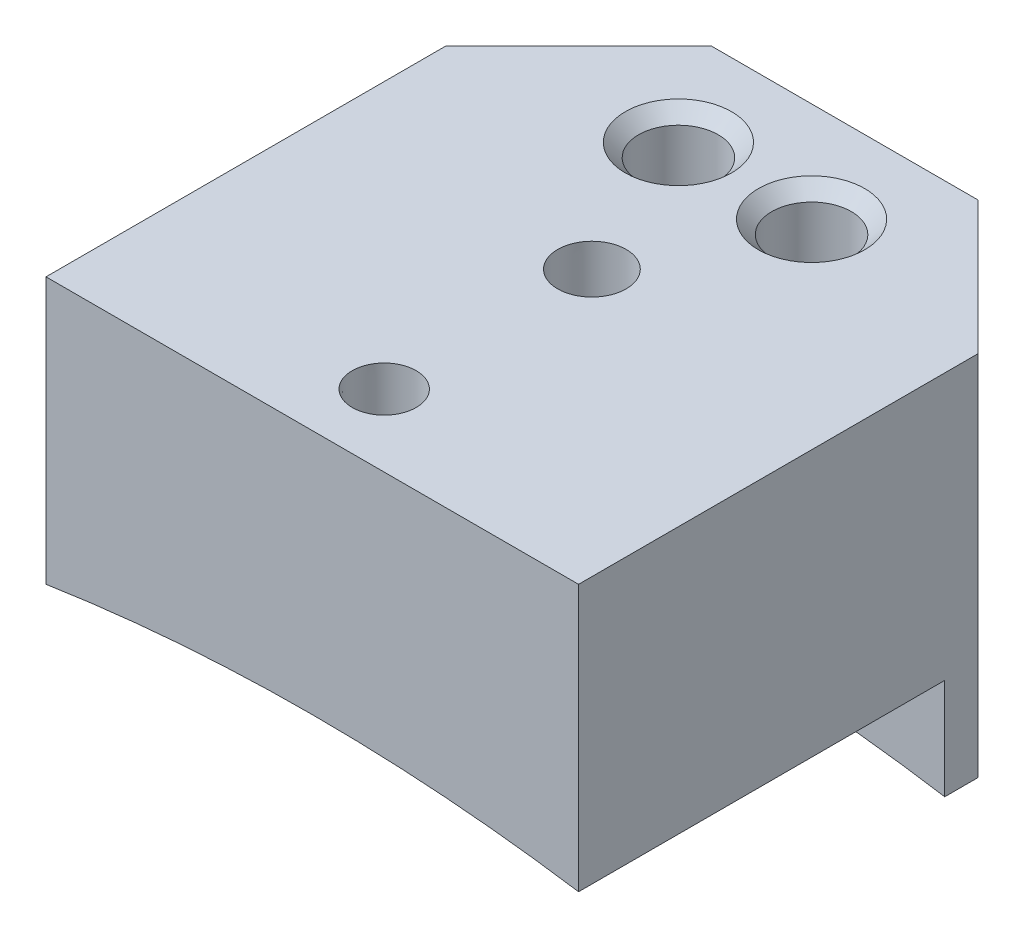
from build123d import *

# Parameters (mm, degrees)
BOSS_EXTRUDE1_DEPTH              = 12.7
CUT_EXTRUDE1_DEPTH               = 41.241448839
CUT_EXTRUDE1_DEPTH_BACK          = 41.241448839
SKETCH2_R                        = 83.82
BOSS_EXTRUDE2_DEPTH              = 7.9375
CHAMFER1_SIZE                    = 6.35
F_10_24_TAPPED_HOLE1_D           = 3.7973
F_10_24_TAPPED_HOLE1_CSINK_D     = 5.0673
F_10_24_TAPPED_HOLE1_CSINK_ANGLE = 90
CUT_EXTRUDE2_DEPTH               = 36.839626758


with BuildPart() as part:
    # Sketch1 → Boss-Extrude1 (new body)
    with BuildSketch(Plane(origin=(0, 0, 0), x_dir=(1, 0, 0), z_dir=(0, 1, 0))):
        Polygon((-28.511825699, 6.495271113), (-22.161825699, 12.845271113), (-9.461825699, 12.845271113), (-3.111825699, 6.495271113), (-3.111825699, -12.554728887), (-28.511825699, -12.554728887), align=None)
    extrude(amount=BOSS_EXTRUDE1_DEPTH)

    # Sketch2 → Cut-Extrude1 (cut, two sides: drawn at the far end of the back side and taken through both)
    with BuildSketch(Plane.XY.offset(12.554728887).offset(-CUT_EXTRUDE1_DEPTH_BACK)):
        with Locations((-15.811825699, -82.852292666)):
            Circle(SKETCH2_R)
    extrude(amount=CUT_EXTRUDE1_DEPTH + CUT_EXTRUDE1_DEPTH_BACK, mode=Mode.SUBTRACT)

    # Sketch5 → Boss-Extrude2 (add)
    with BuildSketch(Plane(origin=(0, 0, -12.845271113), x_dir=(-1, 0, 0), z_dir=(0, 0, -1))):
        with BuildLine():
            Line((3.111825699, 12.7), (3.111825699, 0))
            Line((3.111825699, 0), (3.111825699, -4.808673272))
            ThreePointArc((3.111825699, -4.808673272), (15.811825699, -3.782092666), (28.511825699, -4.808673272))
            Line((28.511825699, -4.808673272), (28.511825699, 0))
            Line((28.511825699, 0), (28.511825699, 12.7))
            Line((28.511825699, 12.7), (3.111825699, 12.7))
        make_face()
    extrude(amount=-BOSS_EXTRUDE2_DEPTH)

    # Chamfer1
    chamfer1_edges = [part.edges().sort_by_distance(p)[0] for p in [
        (-28.511825699, 3.945663364, -12.845271113),
        (-3.111825699, 3.945663364, -12.845271113),
    ]]
    chamfer(chamfer1_edges, length=CHAMFER1_SIZE)

    # #10-24 Tapped Hole1 (through all)
    with Locations(Plane(origin=(0, 12.7, 0), x_dir=(1, 0, 0), z_dir=(0, 1, 0))):
        with Locations((-18.986825699, 8.082771113), (-12.636825699, 8.082771113)):
            CounterSinkHole(F_10_24_TAPPED_HOLE1_D / 2, F_10_24_TAPPED_HOLE1_CSINK_D / 2, counter_sink_angle=F_10_24_TAPPED_HOLE1_CSINK_ANGLE)

    # Sketch6 → Cut-Extrude2 (cut, through all)
    with BuildSketch(Plane(origin=(0, 12.7, 0), x_dir=(1, 0, 0), z_dir=(0, 1, 0))):
        with BuildLine():
            add(Edge.make_bspline(
                [(-15.810187161, -10.649728887), (-15.608816069, -10.649728887), (-15.408777087, -10.609258042), (-15.042113414, -10.456913102), (-14.872283136, -10.343310195), (-14.661403237, -10.132093223), (-14.597095235, -10.053567675), (-14.486747252, -9.887951619), (-14.439987535, -9.800364966), (-14.325350321, -9.523041064), (-14.285983587, -9.325167956), (-14.286290626, -9.023681247), (-14.296234835, -8.924756645), (-14.335129975, -8.729941243), (-14.364583859, -8.633021866), (-14.441157352, -8.448760184), (-14.488024203, -8.361269055), (-14.59887818, -8.19554373), (-14.663276798, -8.117242645), (-14.874254427, -7.906673959), (-15.044430287, -7.793212195), (-15.411336895, -7.641510946), (-15.611812582, -7.601658558), (-15.910183793, -7.601764194), (-16.011184079, -7.611765087), (-16.206424053, -7.650777196), (-16.30141986, -7.679610607), (-16.578437934, -7.794438792), (-16.746192198, -7.906327472), (-16.959455446, -8.119808368), (-17.022421419, -8.196790525), (-17.132721662, -8.361961239), (-17.180436007, -8.451221081), (-17.256716781, -8.635734127), (-17.285478891, -8.730735016), (-17.324351045, -8.926195298), (-17.33424011, -9.027147637), (-17.3340816, -9.325321862), (-17.294056516, -9.525871287), (-17.142043719, -9.892631786), (-17.028500472, -10.062651874), (-16.817622682, -10.273567653), (-16.739189096, -10.337937728), (-16.573527751, -10.448531182), (-16.4859941, -10.495341779), (-16.301435, -10.571837459), (-16.204652049, -10.601138186), (-16.009875231, -10.63984903), (-15.910872707, -10.649728887), (-15.810187161, -10.649728887)],
                knots=[0, 0, 0, 0, 0.0625, 0.0625, 0.125, 0.125, 0.15625, 0.15625, 0.1875, 0.1875, 0.25, 0.25, 0.28125, 0.28125, 0.3125, 0.3125, 0.34375, 0.34375, 0.375, 0.375, 0.4375, 0.4375, 0.5, 0.5, 0.53125, 0.53125, 0.5625, 0.5625, 0.625, 0.625, 0.65625, 0.65625, 0.6875, 0.6875, 0.71875, 0.71875, 0.75, 0.75, 0.8125, 0.8125, 0.875, 0.875, 0.90625, 0.90625, 0.9375, 0.9375, 0.96875, 0.96875, 1, 1, 1, 1], degree=3))
        make_face()
        with BuildLine():
            add(Edge.make_bspline(
                [(-17.442014074, 0.780271113), (-17.442014074, 0.564636284), (-17.398676558, 0.350427917), (-17.235540464, -0.042207871), (-17.113890664, -0.224067842), (-16.887712317, -0.449885239), (-16.803624494, -0.518748425), (-16.626277278, -0.636912744), (-16.532486538, -0.686984635), (-16.235518686, -0.809742063), (-16.023629558, -0.851897237), (-15.700787746, -0.851568442), (-15.594856021, -0.840919858), (-15.386241213, -0.799269638), (-15.2824567, -0.767729417), (-15.085143228, -0.685731965), (-14.991454814, -0.635545363), (-14.813990575, -0.51683914), (-14.730143192, -0.447878932), (-14.50465928, -0.22195697), (-14.383160661, -0.039726886), (-14.220713993, 0.353169004), (-14.178038765, 0.567845014), (-14.178151883, 0.887350822), (-14.188861164, 0.995505271), (-14.230636596, 1.204574676), (-14.261512351, 1.30629934), (-14.343486893, 1.504059479), (-14.394580348, 1.59939761), (-14.512809992, 1.776109619), (-14.580489093, 1.858699522), (-14.732890677, 2.010945721), (-14.815325719, 2.078371766), (-14.992196017, 2.196484915), (-15.087778447, 2.247579015), (-15.285361108, 2.329262955), (-15.387091204, 2.360062361), (-15.596396557, 2.401687932), (-15.704499652, 2.412277461), (-16.023794479, 2.412107726), (-16.238549476, 2.369247574), (-16.631288933, 2.206467282), (-16.813352191, 2.084881425), (-17.03920796, 1.859066471), (-17.10813762, 1.77507717), (-17.226564819, 1.597681506), (-17.276691184, 1.503947566), (-17.358605332, 1.306315551), (-17.389981529, 1.202677168), (-17.431434394, 0.994103708), (-17.442014074, 0.888088528), (-17.442014074, 0.780271113)],
                knots=[0, 0, 0, 0, 0.0625, 0.0625, 0.125, 0.125, 0.15625, 0.15625, 0.1875, 0.1875, 0.25, 0.25, 0.28125, 0.28125, 0.3125, 0.3125, 0.34375, 0.34375, 0.375, 0.375, 0.4375, 0.4375, 0.5, 0.5, 0.53125, 0.53125, 0.5625, 0.5625, 0.59375, 0.59375, 0.625, 0.625, 0.65625, 0.65625, 0.6875, 0.6875, 0.71875, 0.71875, 0.75, 0.75, 0.8125, 0.8125, 0.875, 0.875, 0.90625, 0.90625, 0.9375, 0.9375, 0.96875, 0.96875, 1, 1, 1, 1], degree=3))
        make_face()
    extrude(amount=-CUT_EXTRUDE2_DEPTH, mode=Mode.SUBTRACT)


solid = part.part
